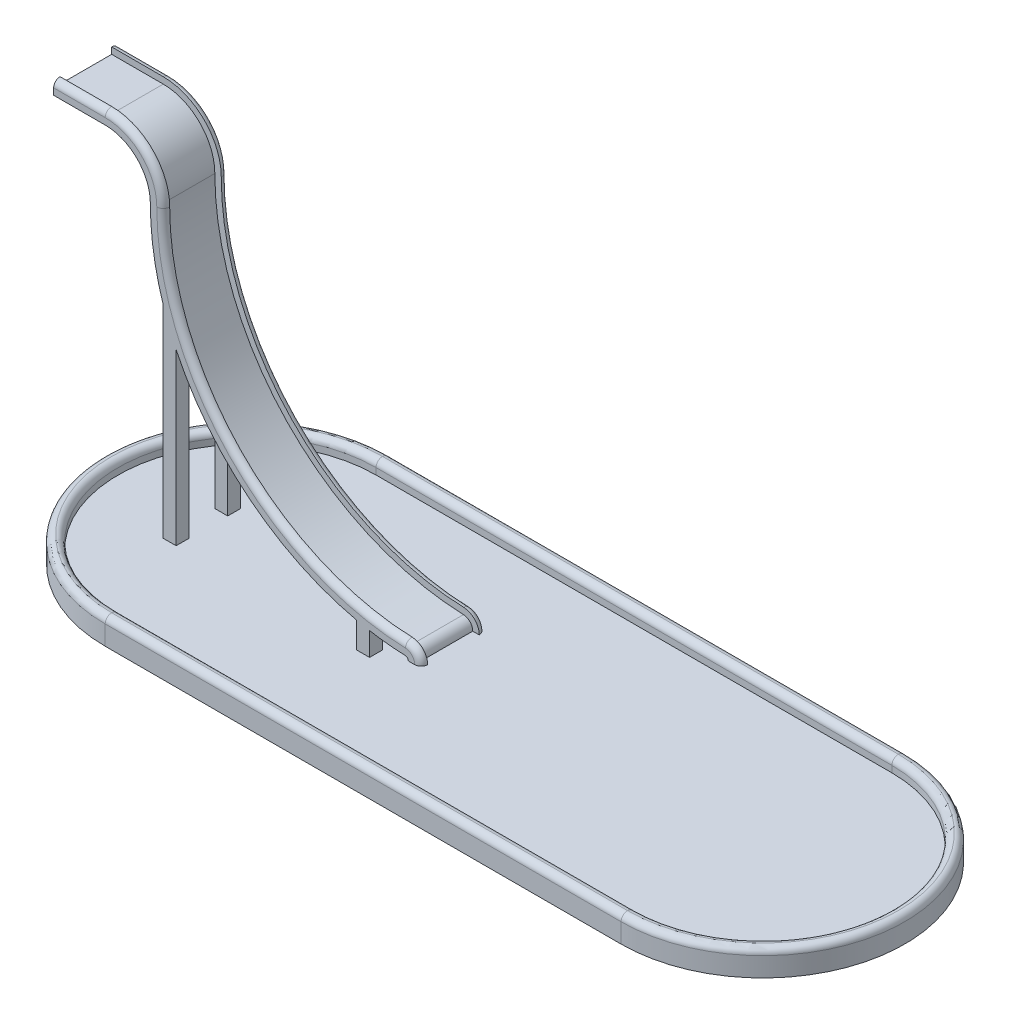
from build123d import *

# Parameters (mm, degrees)
SKETCH_1_W      = 4
SKETCH_1_H      = 6
EXTRUDE_1_DEPTH = 10
EXTRUDE_2_DEPTH = 20
SKETCH_1_4_W    = 4
SKETCH_1_4_H    = 6
EXTRUDE_3_DEPTH = 10
FILLET_1_R      = 5
EXTRUDE_4_DEPTH = 25
EXTRUDE_START   = 25
EXTRUDE_5_DEPTH = 5
EXTRUDE_START_2 = -25
EXTRUDE_6_DEPTH = 5
EXTRUDE_START_3 = 15
EXTRUDE_7_DEPTH = 10
EXTRUDE_8_DEPTH = 10
FILLET_2_R      = 5


with BuildPart() as part:
    # Эскиз1 → Бобышка-Вытянуть1 (new body)
    with BuildSketch(Plane(origin=(0, 0, 0), x_dir=(1, 0, 0), z_dir=(0, 1, 0))):
        with BuildLine():
            Line((-200, -100), (200, -100))
            ThreePointArc((200, -100), (300, 0), (200, 100))
            Line((200, 100), (-200, 100))
            ThreePointArc((-200, 100), (-300, 0), (-200, -100))
        make_face()
        with Locations((-242, 18)):
            Rectangle(SKETCH_1_W, SKETCH_1_H, mode=Mode.SUBTRACT)
        with Locations((-242, -18)):
            Rectangle(SKETCH_1_W, SKETCH_1_H, mode=Mode.SUBTRACT)
    extrude(amount=EXTRUDE_1_DEPTH)

    # Эскиз1<3> → Бобышка-Вытянуть2 (add)
    with BuildSketch(Plane(origin=(0, 0, 0), x_dir=(1, 0, 0), z_dir=(0, 1, 0))):
        with BuildLine():
            Line((-200, 110), (200, 110))
            ThreePointArc((200, 110), (310, 0), (200, -110))
            Line((200, -110), (-200, -110))
            ThreePointArc((-200, -110), (-310, 0), (-200, 110))
        make_face()
        with BuildLine():
            ThreePointArc((200, -100), (300, 0), (200, 100))
            Line((200, 100), (-200, 100))
            ThreePointArc((-200, 100), (-300, 0), (-200, -100))
            Line((-200, -100), (200, -100))
        make_face(mode=Mode.SUBTRACT)
    extrude(amount=EXTRUDE_2_DEPTH)

    # Эскиз1<4> → Бобышка-Вытянуть3 (add)
    with BuildSketch(Plane(origin=(0, 0, 0), x_dir=(1, 0, 0), z_dir=(0, 1, 0))):
        with Locations((-242, 18)):
            Rectangle(SKETCH_1_4_W, SKETCH_1_4_H)
        with Locations((-242, -18)):
            Rectangle(SKETCH_1_4_W, SKETCH_1_4_H)
    extrude(amount=EXTRUDE_3_DEPTH)

    # Скругление1
    fillet_1_edges = [part.edges().sort_by_distance(p)[0] for p in [
        (0, 20, -110),
        (300, 20, 0),
        (0, 20, 100),
        (-300, 20, 0),
        (0, 20, -100),
        (-310, 20, 0),
        (0, 20, 110),
        (310, 20, 0),
    ]]
    fillet(fillet_1_edges, radius=FILLET_1_R - 0.0001)  # a hair under: the kernel refuses the full size



with BuildPart() as body_2:
    # Эскиз2 → Бобышка-Вытянуть4 (new, symmetric)
    with BuildSketch(Plane.XY):
        with BuildLine():
            ThreePointArc((-245, 230), (-256.715728753, 258.284271247), (-285, 270))
            Line((-285, 270), (-325, 270))
            Line((-325, 270), (-325, 265))
            Line((-325, 265), (-285, 265))
            ThreePointArc((-285, 265), (-260.251262658, 254.748737342), (-250, 230))
            ThreePointArc((-250, 230), (-247.484567313, 197.984378813), (-240, 166.754446797))
            ThreePointArc((-240, 166.754446797), (-235.413108769, 154.053650458), (-230, 141.682391337))
            ThreePointArc((-230, 141.682391337), (-172.840678712, 69.744700973), (-90, 30))
            ThreePointArc((-90, 30), (-85.012374627, 28.942769648), (-80, 28.009901233))
            ThreePointArc((-80, 28.009901233), (-66.253520421, 26.104713469), (-52.409638554, 25.133952895))
            ThreePointArc((-52.409638554, 25.133952895), (-50.700569032, 24.371111803), (-50, 22.635586467))
            Line((-50, 22.635586467), (-45, 22.635586467))
            ThreePointArc((-45, 22.635586467), (-47.101707097, 27.842162475), (-52.228915663, 30.130685751))
            ThreePointArc((-52.228915663, 30.130685751), (-188.95447741, 91.1579731), (-245, 230))
        make_face()
    extrude(amount=EXTRUDE_4_DEPTH, both=True)


with BuildPart() as body_3:
    # Эскиз2<4> → Бобышка-Вытянуть5 (new body)
    with BuildSketch(Plane.XY.offset(EXTRUDE_START)):
        with BuildLine():
            Line((-325, 270), (-285, 270))
            ThreePointArc((-285, 270), (-256.715728753, 258.284271247), (-245, 230))
            ThreePointArc((-245, 230), (-188.95447741, 91.1579731), (-52.228915663, 30.130685751))
            ThreePointArc((-52.228915663, 30.130685751), (-47.101707097, 27.842162475), (-45, 22.635586467))
            Line((-45, 22.635586467), (-40, 22.635586467))
            ThreePointArc((-40, 22.635586467), (-43.502845162, 31.313213148), (-52.048192771, 35.127418607))
            ThreePointArc((-52.048192771, 35.127418607), (-185.355615474, 94.629023772), (-240, 230))
            ThreePointArc((-240, 230), (-253.180194847, 261.819805153), (-285, 275))
            Line((-285, 275), (-325, 275))
            Line((-325, 275), (-325, 270))
        make_face()
    extrude(amount=-EXTRUDE_5_DEPTH)


with BuildPart() as body_4:
    # Эскиз2<5> → Бобышка-Вытянуть6 (new body)
    with BuildSketch(Plane.XY.offset(EXTRUDE_START_2)):
        with BuildLine():
            Line((-325, 270), (-285, 270))
            ThreePointArc((-285, 270), (-256.715728753, 258.284271247), (-245, 230))
            ThreePointArc((-245, 230), (-188.95447741, 91.1579731), (-52.228915663, 30.130685751))
            ThreePointArc((-52.228915663, 30.130685751), (-47.101707097, 27.842162475), (-45, 22.635586467))
            Line((-45, 22.635586467), (-40, 22.635586467))
            ThreePointArc((-40, 22.635586467), (-43.502845162, 31.313213148), (-52.048192771, 35.127418607))
            ThreePointArc((-52.048192771, 35.127418607), (-185.355615474, 94.629023772), (-240, 230))
            ThreePointArc((-240, 230), (-253.180194847, 261.819805153), (-285, 275))
            Line((-285, 275), (-325, 275))
            Line((-325, 275), (-325, 270))
        make_face()
    extrude(amount=EXTRUDE_6_DEPTH)



with BuildPart() as part_1:
    add(part.part)

    add(body_2.part)  # Бобышка-Вытянуть7 merges body 2

    add(body_3.part)  # Бобышка-Вытянуть7 merges body 3
    # Эскиз2<8> → Бобышка-Вытянуть7 (add)
    with BuildSketch(Plane.XY.offset(EXTRUDE_START_3)):
        with BuildLine():
            ThreePointArc((-230, 141.682391337), (-235.413108769, 154.053650458), (-240, 166.754446797))
            Line((-240, 166.754446797), (-240, 0))
            Line((-240, 0), (-230, 0))
            Line((-230, 0), (-230, 141.682391337))
        make_face()
        with BuildLine():
            Line((-80, 0), (-80, 28.009901233))
            ThreePointArc((-80, 28.009901233), (-85.012374627, 28.942769648), (-90, 30))
            Line((-90, 30), (-90, 0))
            Line((-90, 0), (-80, 0))
        make_face()
    extrude(amount=EXTRUDE_7_DEPTH)


with BuildPart() as body_4_1:
    add(body_4.part)

    add(part_1.part)  # Бобышка-Вытянуть8 merges part
    # Эскиз2<9> → Бобышка-Вытянуть8 (add)
    with BuildSketch(Plane.XY.offset(EXTRUDE_START_2)):
        with BuildLine():
            ThreePointArc((-230, 141.682391337), (-235.413108769, 154.053650458), (-240, 166.754446797))
            Line((-240, 166.754446797), (-240, 0))
            Line((-240, 0), (-230, 0))
            Line((-230, 0), (-230, 141.682391337))
        make_face()
        with BuildLine():
            Line((-80, 0), (-80, 28.009901233))
            ThreePointArc((-80, 28.009901233), (-85.012374627, 28.942769648), (-90, 30))
            Line((-90, 30), (-90, 0))
            Line((-90, 0), (-80, 0))
        make_face()
    extrude(amount=EXTRUDE_8_DEPTH)

    # Скругление2
    fillet_2_edges = [body_4_1.edges().sort_by_distance(p)[0] for p in [
        (-305, 275, -25),
        (-253.180194847, 261.819805153, -25),
        (-43.502845162, 31.313213148, -25),
        (-305, 275, 25),
        (-253.180194847, 261.819805153, 25),
        (-43.502845162, 31.313213148, 25),
        (-185.355615474, 94.629023772, -25),
        (-185.355615474, 94.629023772, 25),
    ]]
    fillet(fillet_2_edges, radius=FILLET_2_R - 0.0001)  # a hair under: the kernel refuses the full size


solid = body_4_1.part
